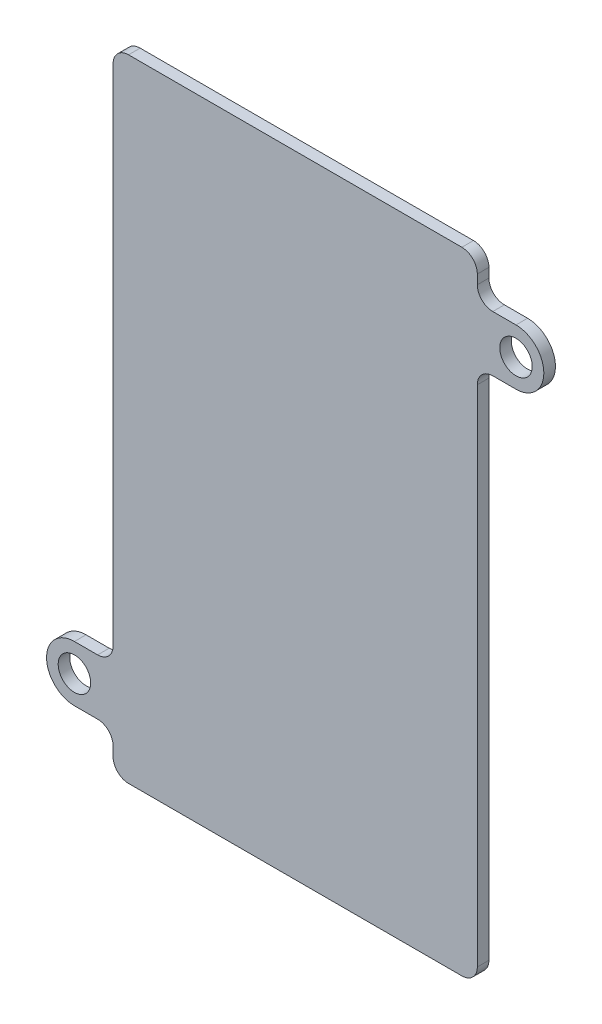
from build123d import *

# Parameters (mm, degrees)
SKETCH1_R           = 2.1
BOSS_EXTRUDE1_DEPTH = 1.5
FILLET1_R           = 2


with BuildPart() as part:
    # Sketch1 → Boss-Extrude1 (new body)
    with BuildSketch(Plane(origin=(0, 0, 0), x_dir=(-1, 0, 0), z_dir=(0, 0, -1))):
        with BuildLine():
            Line((-23.55, 40.8), (-23.55, 35.6))
            Line((-23.55, 35.6), (-28.55, 35.6))
            ThreePointArc((-28.55, 35.6), (-32.15, 32), (-28.55, 28.4))
            Line((-28.55, 28.4), (-23.55, 28.4))
            Line((-23.55, 28.4), (-23.55, -40.8))
            Line((-23.55, -40.8), (23.55, -40.8))
            Line((23.55, -40.8), (23.55, -35.6))
            Line((23.55, -35.6), (28.55, -35.6))
            ThreePointArc((28.55, -35.6), (32.15, -32), (28.55, -28.4))
            Line((28.55, -28.4), (23.55, -28.4))
            Line((23.55, -28.4), (23.55, 40.8))
            Line((23.55, 40.8), (-23.55, 40.8))
        make_face()
        with Locations((28.55, -32)):
            Circle(SKETCH1_R, mode=Mode.SUBTRACT)
        with Locations((-28.55, 32)):
            Circle(SKETCH1_R, mode=Mode.SUBTRACT)
    extrude(amount=BOSS_EXTRUDE1_DEPTH)

    # Fillet1
    fillet1_edges = [part.edges().sort_by_distance(p)[0] for p in [
        (23.55, 28.4, -0.75),
        (-23.55, -28.4, -0.75),
        (23.55, 35.6, -0.75),
        (23.55, 40.8, -0.75),
        (-23.55, 40.8, -0.75),
        (23.55, -40.8, -0.75),
        (-23.55, -40.8, -0.75),
        (-23.55, -35.6, -0.75),
    ]]
    fillet(fillet1_edges, radius=FILLET1_R)


solid = part.part
